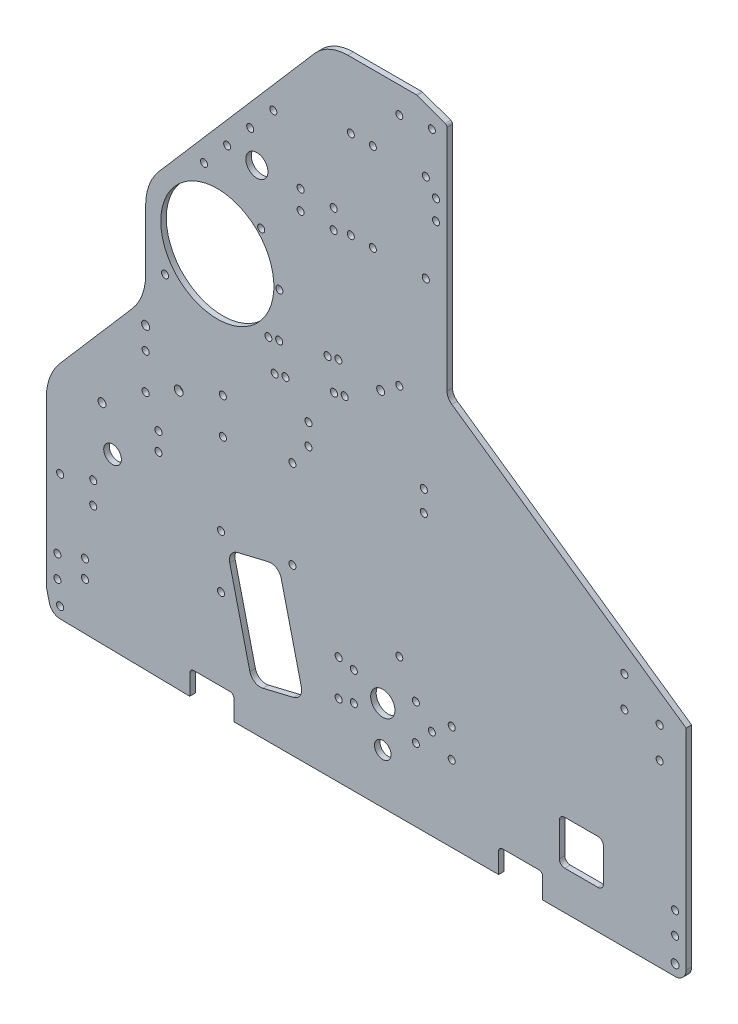
from build123d import *

# Parameters (mm, degrees)
SKETCH1_R           = 2.032
SKETCH1_R_2         = 5.08
SKETCH1_R_3         = 2.54
SKETCH1_R_4         = 2
BOSS_EXTRUDE1_DEPTH = 3.175
FILLET1_R           = 2.286
FILLET2_R           = 6.35
SKETCH2_R           = 2.032
CUT_EXTRUDE1_DEPTH  = 505.524983177
FILLET3_R           = 1.5875
SKETCH3_R           = 2.032
SKETCH3_R_2         = 2.286
CUT_EXTRUDE2_DEPTH  = 505.524983177
SKETCH4_R           = 2.032
SKETCH4_R_2         = 6.985
SKETCH4_R_3         = 4.7625
CUT_EXTRUDE3_DEPTH  = 505.524983177
SKETCH5_R           = 32.54375
SKETCH5_R_2         = 2.286000001
CUT_EXTRUDE5_DEPTH  = 505.524983177
FILLET4_R           = 31.75
CUT_EXTRUDE6_DEPTH  = 505.524983177
FILLET5_R           = 25.4
SKETCH8_R           = 2.031999999
SKETCH8_R_2         = 2.032000002
SKETCH8_R_3         = 2.031999998
CUT_EXTRUDE7_DEPTH  = 505.524983177
SKETCH10_R          = 2.032
CUT_EXTRUDE8_DEPTH  = 505.524983177
FILLET6_R           = 6.35
SKETCH11_RX         = 2.032
SKETCH11_RY         = 2.031999502
CUT_EXTRUDE9_DEPTH  = 505.524983177
SKETCH12_R          = 2.032
CUT_EXTRUDE10_DEPTH = 505.524983319
SKETCH14_R          = 6.375981846
CUT_EXTRUDE11_DEPTH = 505.524983319
SKETCH15_R          = 2.286
CUT_EXTRUDE12_DEPTH = 505.524983319


with BuildPart() as part:
    # Sketch1 → Boss-Extrude1 (new body)
    with BuildSketch(Plane.XY):
        with BuildLine():
            Line((7.829508682, -19.049081656), (82.55, -20.32))
            Line((82.55, -20.32), (82.55, -6.35))
            Line((82.55, -6.35), (107.95, -6.35))
            Line((107.95, -6.35), (107.95, -20.32))
            Line((107.95, -20.32), (260.35, -20.32))
            Line((260.35, -20.32), (260.35, -6.35))
            Line((260.35, -6.35), (285.75, -6.35))
            Line((285.75, -6.35), (285.75, -20.32))
            Line((285.75, -20.32), (368.3, -20.32))
            Line((368.3, -20.32), (368.3, 106.68))
            Line((368.3, 106.68), (230.66375, 202.565))
            Line((230.66375, 202.565), (230.66375, 338.455))
            Line((230.66375, 338.455), (213.19998, 344.805))
            Line((213.19998, 344.805), (203.2, 344.805))
            Line((203.2, 344.805), (161.925, 344.805))
            Line((161.925, 344.805), (52.720122664, 218.469945827))
            ThreePointArc((52.720122664, 218.469945827), (52.803835479, 218.142145922), (52.832, 217.805))
            ThreePointArc((52.832, 217.805), (52.095493096, 216.239521914), (50.419872403, 215.808871996))
            Line((50.419872403, 215.808871996), (0, 157.48))
            Line((0, 157.48), (0, 0))
            Line((0, 0), (0, -6.35))
            ThreePointArc((0, -6.35), (0.047577015, -7.125863724), (0.189595124, -7.890101219))
            Line((0.189595124, -7.890101219), (1.777095124, -14.240101219))
            ThreePointArc((1.777095124, -14.240101219), (3.987212552, -17.671692778), (7.829508682, -19.049081656))
        make_face()
        with Locations((7.9375, -12.7)):
            Circle(SKETCH1_R, mode=Mode.SUBTRACT)
        with Locations((6.35, 0)):
            Circle(SKETCH1_R, mode=Mode.SUBTRACT)
        with Locations((6.35, 12.7)):
            Circle(SKETCH1_R, mode=Mode.SUBTRACT)
        with Locations((38.1, 78.105)):
            Circle(SKETCH1_R_2, mode=Mode.SUBTRACT)
        with Locations((57.15, 118.58625)):
            Circle(SKETCH1_R, mode=Mode.SUBTRACT)
        with Locations((57.15, 139.22375)):
            Circle(SKETCH1_R, mode=Mode.SUBTRACT)
        with Locations((76.2, 128.905)):
            Circle(SKETCH1_R_3, mode=Mode.SUBTRACT)
        with Locations((101.6, 118.58625)):
            Circle(SKETCH1_R, mode=Mode.SUBTRACT)
        with Locations((101.6, 139.22375)):
            Circle(SKETCH1_R, mode=Mode.SUBTRACT)
        with Locations((203.2, 59.805)):
            Circle(SKETCH1_R_4, mode=Mode.SUBTRACT)
        with Locations((361.95, 0)):
            Circle(SKETCH1_R, mode=Mode.SUBTRACT)
        with Locations((361.95, 12.7)):
            Circle(SKETCH1_R, mode=Mode.SUBTRACT)
        with Locations((353.06, 82.955052336)):
            Circle(SKETCH1_R, mode=Mode.SUBTRACT)
        with Locations((332.74, 98.195052336)):
            Circle(SKETCH1_R, mode=Mode.SUBTRACT)
        with Locations((332.74, 115.975052336)):
            Circle(SKETCH1_R, mode=Mode.SUBTRACT)
        with Locations((353.06, 100.735052336)):
            Circle(SKETCH1_R, mode=Mode.SUBTRACT)
        with Locations((68.326, 182.923674932)):
            Circle(SKETCH1_R, mode=Mode.SUBTRACT)
        with Locations((76.2, 217.805)):
            Circle(SKETCH1_R, mode=Mode.SUBTRACT)
        with Locations((90.779500502, 249.682)):
            Circle(SKETCH1_R, mode=Mode.SUBTRACT)
        with Locations((104.067838673, 265.054783374)):
            Circle(SKETCH1_R, mode=Mode.SUBTRACT)
        with Locations((117.356176844, 280.427566748)):
            Circle(SKETCH1_R, mode=Mode.SUBTRACT)
        with Locations((130.644515014, 295.800350122)):
            Circle(SKETCH1_R, mode=Mode.SUBTRACT)
        with Locations((203.2, 194.805)):
            Circle(SKETCH1_R_4, mode=Mode.SUBTRACT)
        with Locations((224.31375, 287.401)):
            Circle(SKETCH1_R, mode=Mode.SUBTRACT)
        with Locations((224.31375, 298.831)):
            Circle(SKETCH1_R, mode=Mode.SUBTRACT)
        with Locations((203.2, 329.805)):
            Circle(SKETCH1_R_4, mode=Mode.SUBTRACT)
        with Locations((221.931865, 332.105)):
            Circle(SKETCH1_R_4, mode=Mode.SUBTRACT)
    extrude(amount=BOSS_EXTRUDE1_DEPTH)

    # Fillet1
    fillet1_edges = [part.edges().sort_by_distance(p)[0] for p in [
        (285.75, -6.35, 1.5875),
        (107.95, -6.35, 1.5875),
        (260.35, -6.35, 1.5875),
        (82.55, -6.35, 1.5875),
    ]]
    fillet(fillet1_edges, radius=FILLET1_R)

    # Fillet2
    fillet2_edges = [part.edges().sort_by_distance(p)[0] for p in [
        (230.66375, 202.565, 1.5875),
    ]]
    fillet(fillet2_edges, radius=FILLET2_R)

    # Sketch2 → Cut-Extrude1 (cut, through all)
    with BuildSketch(Plane(origin=(0, 0, 0), x_dir=(-1, 0, 0), z_dir=(0, 0, -1))):
        with Locations((-100.552770272, 71.086035298)):
            Circle(SKETCH2_R)
        with Locations((-100.552770272, 40.606035298)):
            Circle(SKETCH2_R)
        with Locations((-22.225, 18.202541089)):
            Circle(SKETCH2_R)
        with Locations((-22.225, 8.042541089)):
            Circle(SKETCH2_R)
    extrude(amount=-CUT_EXTRUDE1_DEPTH, mode=Mode.SUBTRACT)

    # Fillet3
    fillet3_edges = [part.edges().sort_by_distance(p)[0] for p in [
        (230.66375, 338.455, 1.5875),
        (213.19998, 344.805, 1.5875),
    ]]
    fillet(fillet3_edges, radius=FILLET3_R)

    # Sketch3 → Cut-Extrude2 (cut, through all)
    with BuildSketch(Plane.XY.offset(3.175)):
        with BuildLine():
            Line((127.789350211, 69.359774106), (110.090750339, 65.117184968))
            ThreePointArc((110.090750339, 65.117184968), (106.287939856, 62.356288953), (105.55119507, 57.715047577))
            Line((105.55119507, 57.715047577), (117.160037875, 9.287010566))
            ThreePointArc((117.160037875, 9.287010566), (119.92093389, 5.484200083), (124.562175266, 4.747455297))
            Line((124.562175266, 4.747455297), (142.260775137, 8.990044434))
            ThreePointArc((142.260775137, 8.990044434), (146.063585621, 11.75094045), (146.800330407, 16.392181825))
            Line((146.800330407, 16.392181825), (135.191487602, 64.820218836))
            ThreePointArc((135.191487602, 64.820218836), (132.430591586, 68.62302932), (127.789350211, 69.359774106))
        make_face()
        with Locations((26.987500002, 46.953113935)):
            Circle(SKETCH3_R)
        with Locations((26.987500002, 59.653113935)):
            Circle(SKETCH3_R)
        with Locations((7.937500002, 53.303113935)):
            Circle(SKETCH3_R)
        with Locations((32.030600738, 100.810868776)):
            Circle(SKETCH3_R_2)
        with Locations((64.525942114, 102.94048958)):
            Circle(SKETCH3_R)
        with Locations((64.525942114, 92.525786339)):
            Circle(SKETCH3_R)
        with Locations((134.14375, 208.228121768)):
            Circle(SKETCH3_R)
        with Locations((123.681970341, 233.485092108)):
            Circle(SKETCH3_R)
    extrude(amount=-CUT_EXTRUDE2_DEPTH, mode=Mode.SUBTRACT)

    # Sketch4 → Cut-Extrude3 (cut, through all)
    with BuildSketch(Plane.XY.offset(3.175)):
        with Locations((168.275, 42.06875)):
            Circle(SKETCH4_R)
        with Locations((212.725, 42.06875)):
            Circle(SKETCH4_R)
        with Locations((212.725, 21.43125)):
            Circle(SKETCH4_R)
        with Locations((168.275, 21.43125)):
            Circle(SKETCH4_R)
        with Locations((193.675, 31.75)):
            Circle(SKETCH4_R_2)
        with Locations((177.00498, 40.0431)):
            Circle(SKETCH4_R)
        with Locations((177.00498, 23.4569)):
            Circle(SKETCH4_R)
        with Locations((193.675, 8.466666658)):
            Circle(SKETCH4_R_3)
        with Locations((221.931865, 31.75)):
            Circle(SKETCH4_R)
        with Locations((233.36123, 23.4569)):
            Circle(SKETCH4_R)
        with Locations((233.36123, 40.0431)):
            Circle(SKETCH4_R)
    extrude(amount=-CUT_EXTRUDE3_DEPTH, mode=Mode.SUBTRACT)

    # Sketch5 → Cut-Extrude5 (cut, through all)
    with BuildSketch(Plane(origin=(0, 0, 0), x_dir=(-1, 0, 0), z_dir=(0, 0, -1))):
        Polygon((0, 157.48), (-57.15, 223.594705882), (-57.15, 165.333696112), (0, 99.218990229), align=None)
        with Locations((-98.425, 208.228121768)):
            Circle(SKETCH5_R)
        with Locations((-361.95, -13.97)):
            Circle(SKETCH5_R_2)
    extrude(amount=-CUT_EXTRUDE5_DEPTH, mode=Mode.SUBTRACT)

    # Fillet4
    fillet4_edges = [part.edges().sort_by_distance(p)[0] for p in [
        (0, 99.218990229, 1.5875),
        (57.15, 165.333696112, 1.5875),
        (57.15, 223.594705882, 1.5875),
    ]]
    fillet(fillet4_edges, radius=FILLET4_R)

    # Sketch6 → Cut-Extrude6 (cut, through all)
    with BuildSketch(Plane.XY.offset(3.175)):
        with BuildLine():
            Line((298.45, 27.305), (317.5, 27.305))
            ThreePointArc((317.5, 27.305), (319.74506403, 26.37506403), (320.675, 24.13))
            Line((320.675, 24.13), (320.675, 5.08))
            ThreePointArc((320.675, 5.08), (319.74506403, 2.83493597), (317.5, 1.905))
            Line((317.5, 1.905), (298.45, 1.905))
            ThreePointArc((298.45, 1.905), (296.20493597, 2.83493597), (295.275, 5.08))
            Line((295.275, 5.08), (295.275, 24.13))
            ThreePointArc((295.275, 24.13), (296.20493597, 26.37506403), (298.45, 27.305))
        make_face()
    extrude(amount=-CUT_EXTRUDE6_DEPTH, mode=Mode.SUBTRACT)

    # Fillet5
    fillet5_edges = [part.edges().sort_by_distance(p)[0] for p in [
        (161.925, 344.805, 1.5875),
    ]]
    fillet(fillet5_edges, radius=FILLET5_R)

    # Sketch8 → Cut-Extrude7 (cut, through all)
    with BuildSketch(Plane(origin=(0, 0, 0), x_dir=(-1, 0, 0), z_dir=(0, 0, -1))):
        with Locations((-187.96, 306.70500001)):
            Circle(SKETCH8_R)
        with Locations((-187.96, 255.904999997)):
            Circle(SKETCH8_R_2)
        with Locations((-218.44, 306.70500001)):
            Circle(SKETCH8_R_3)
        with Locations((-175.26, 306.70500001)):
            Circle(SKETCH8_R)
        with Locations((-175.26, 255.904999997)):
            Circle(SKETCH8_R_2)
        with Locations((-218.44, 255.904999997)):
            Circle(SKETCH8_R_2)
    extrude(amount=-CUT_EXTRUDE7_DEPTH, mode=Mode.SUBTRACT)

    # Sketch10 → Cut-Extrude8 (cut, through all)
    with BuildSketch(Plane.XY.offset(3.175)):
        with Locations((141.64248, 74.684371768)):
            Circle(SKETCH10_R)
        with Locations((141.64248, 125.484371768)):
            Circle(SKETCH10_R)
    extrude(amount=-CUT_EXTRUDE8_DEPTH, mode=Mode.SUBTRACT)

    # Fillet6
    fillet6_edges = [part.edges().sort_by_distance(p)[0] for p in [
        (368.3, -20.32, 1.5875),
    ]]
    fillet(fillet6_edges, radius=FILLET6_R)

    # Sketch11 → Cut-Extrude9 (cut, through all)
    with BuildSketch(Plane.XY.offset(3.175)):
        with Locations(Location((150.881424454, 138.43), (0, 0, 90))):
            Ellipse(SKETCH11_RX, SKETCH11_RY)
        with Locations(Location((150.881424454, 150.495), (0, 0, 90))):
            Ellipse(SKETCH11_RX, SKETCH11_RY)
        with Locations(Location((217.30240818, 150.495), (0, 0, 90))):
            Ellipse(SKETCH11_RX, SKETCH11_RY)
        with Locations(Location((217.30240818, 138.43), (0, 0, 90))):
            Ellipse(SKETCH11_RX, SKETCH11_RY)
    extrude(amount=-CUT_EXTRUDE9_DEPTH, mode=Mode.SUBTRACT)

    # Sketch12 → Cut-Extrude10 (cut, through all)
    with BuildSketch(Plane(origin=(0, 0, 0), x_dir=(-1, 0, 0), z_dir=(0, 0, -1))):
        with Locations((-165.4175, 264.63498)):
            Circle(SKETCH12_R)
        with Locations((-165.4175, 253.52248)):
            Circle(SKETCH12_R)
        with Locations((-146.3675, 253.52248)):
            Circle(SKETCH12_R)
        with Locations((-146.3675, 264.63498)):
            Circle(SKETCH12_R)
    extrude(amount=-CUT_EXTRUDE10_DEPTH, mode=Mode.SUBTRACT)

    # Sketch14 → Cut-Extrude11 (cut, through all)
    with BuildSketch(Plane(origin=(0, 0, 0), x_dir=(-1, 0, 0), z_dir=(0, 0, -1))):
        with Locations((-121.184716432, 263.688494682)):
            Circle(SKETCH14_R)
    extrude(amount=-CUT_EXTRUDE11_DEPTH, mode=Mode.SUBTRACT)

    # Sketch15 → Cut-Extrude12 (cut, through all)
    with BuildSketch(Plane.XY.offset(3.175)):
        with Locations((57.15, 151.92375)):
            Circle(SKETCH15_R)
        with Locations((192.439038956, 187.119947783)):
            Circle(SKETCH15_R)
        with BuildLine():
            ThreePointArc((163.873739892, 173.680575348), (163.573171662, 172.102507308), (164.512499361, 170.799317578))
            ThreePointArc((164.512499361, 170.799317578), (167.540838635, 172.982117899), (163.873739892, 173.680575348))
        make_face()
        with BuildLine():
            ThreePointArc((173.43975005, 172.778441408), (173.74031828, 174.356509448), (172.800990581, 175.659699178))
            ThreePointArc((172.800990581, 175.659699178), (169.772651307, 173.476898857), (173.43975005, 172.778441408))
        make_face()
        with BuildLine():
            ThreePointArc((169.158852977, 192.088320238), (166.130513703, 189.905519916), (169.797612447, 189.207062467))
            ThreePointArc((169.797612447, 189.207062467), (170.098180676, 190.785130507), (169.158852977, 192.088320238))
        make_face()
        with BuildLine():
            ThreePointArc((160.231602288, 190.109196408), (159.931034058, 188.531128368), (160.870361757, 187.227938638))
            ThreePointArc((160.870361757, 187.227938638), (163.898701031, 189.410738959), (160.231602288, 190.109196408))
        make_face()
        with BuildLine():
            ThreePointArc((129.776601842, 166.121421831), (129.476033612, 164.543353791), (130.415361311, 163.240164061))
            ThreePointArc((130.415361311, 163.240164061), (133.443700585, 165.422964382), (129.776601842, 166.121421831))
        make_face()
        with BuildLine():
            ThreePointArc((139.342612001, 165.219287891), (139.64318023, 166.797355931), (138.703852531, 168.100545661))
            ThreePointArc((138.703852531, 168.100545661), (135.675513257, 165.91774534), (139.342612001, 165.219287891))
        make_face()
        with BuildLine():
            ThreePointArc((135.700474397, 181.647908951), (136.001042627, 183.225976991), (135.061714928, 184.529166721))
            ThreePointArc((135.061714928, 184.529166721), (132.033375654, 182.3463664), (135.700474397, 181.647908951))
        make_face()
        with BuildLine():
            ThreePointArc((126.134464239, 182.550042891), (125.833896009, 180.971974851), (126.773223708, 179.668785121))
            ThreePointArc((126.773223708, 179.668785121), (129.801562982, 181.851585442), (126.134464239, 182.550042891))
        make_face()
    extrude(amount=-CUT_EXTRUDE12_DEPTH, mode=Mode.SUBTRACT)


solid = part.part
